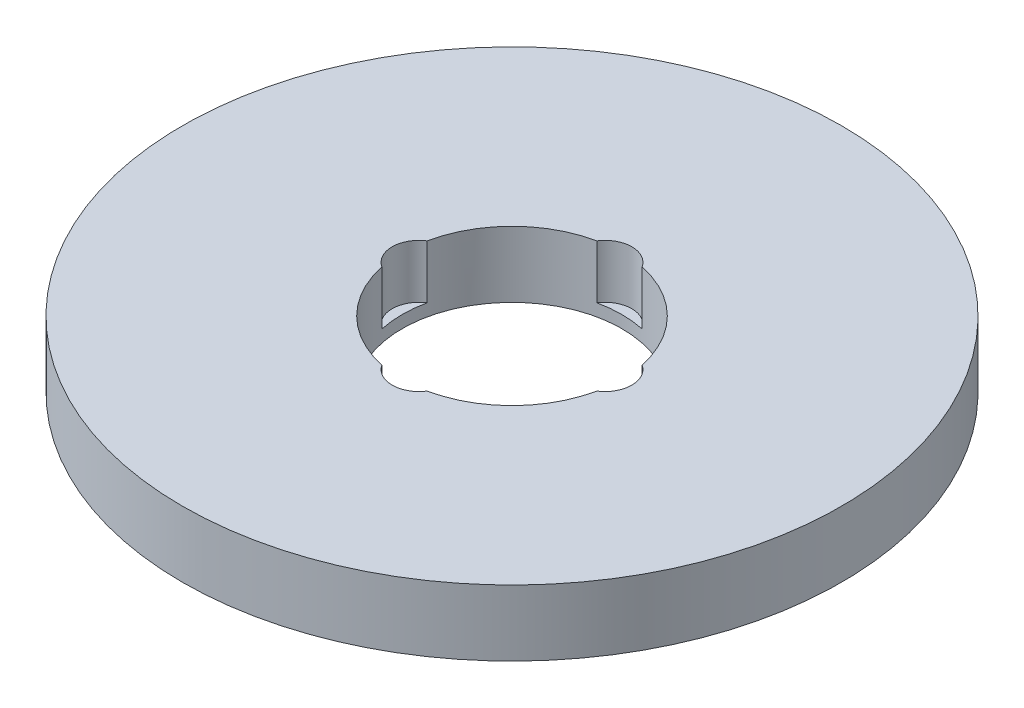
from build123d import *

# Parameters (mm, degrees)
SKETCH1_R           = 45
BOSS_EXTRUDE1_DEPTH = 9
SKETCH2_R           = 15
CUT_EXTRUDE1_DEPTH  = 65.272855857
SKETCH3_R           = 3.668658941
CUT_EXTRUDE2_DEPTH  = 7.329780139
CIRPATTERN1_COUNT   = 4


with BuildPart() as part:
    # Sketch1 → Boss-Extrude1 (new body)
    with BuildSketch(Plane(origin=(0, 0, 0), x_dir=(1, 0, 0), z_dir=(0, 1, 0))):
        Circle(SKETCH1_R)
    extrude(amount=BOSS_EXTRUDE1_DEPTH)

    # Sketch2 → Cut-Extrude1 (cut, through all)
    with BuildSketch(Plane(origin=(0, 0, 0), x_dir=(1, 0, 0), z_dir=(0, 1, 0))):
        Circle(SKETCH2_R)
    extrude(amount=CUT_EXTRUDE1_DEPTH, mode=Mode.SUBTRACT)

    # Sketch3 → Cut-Extrude2 (cut)
    with BuildSketch(Plane(origin=(0, 9, 0), x_dir=(1, 0, 0), z_dir=(0, 1, 0))):
        with Locations((-12.696507902, 0)):
            Circle(SKETCH3_R)
    cut_extrude2 = extrude(amount=-CUT_EXTRUDE2_DEPTH, mode=Mode.SUBTRACT)

    # CirPattern1: Cut-Extrude2 ×4 about axis
    cirpattern1_axis = Axis((0, 0, 0), (0, 1, 0))
    for i in range(1, CIRPATTERN1_COUNT):
        add(cut_extrude2.rotate(cirpattern1_axis, i * 360 / CIRPATTERN1_COUNT), mode=Mode.SUBTRACT)


solid = part.part
